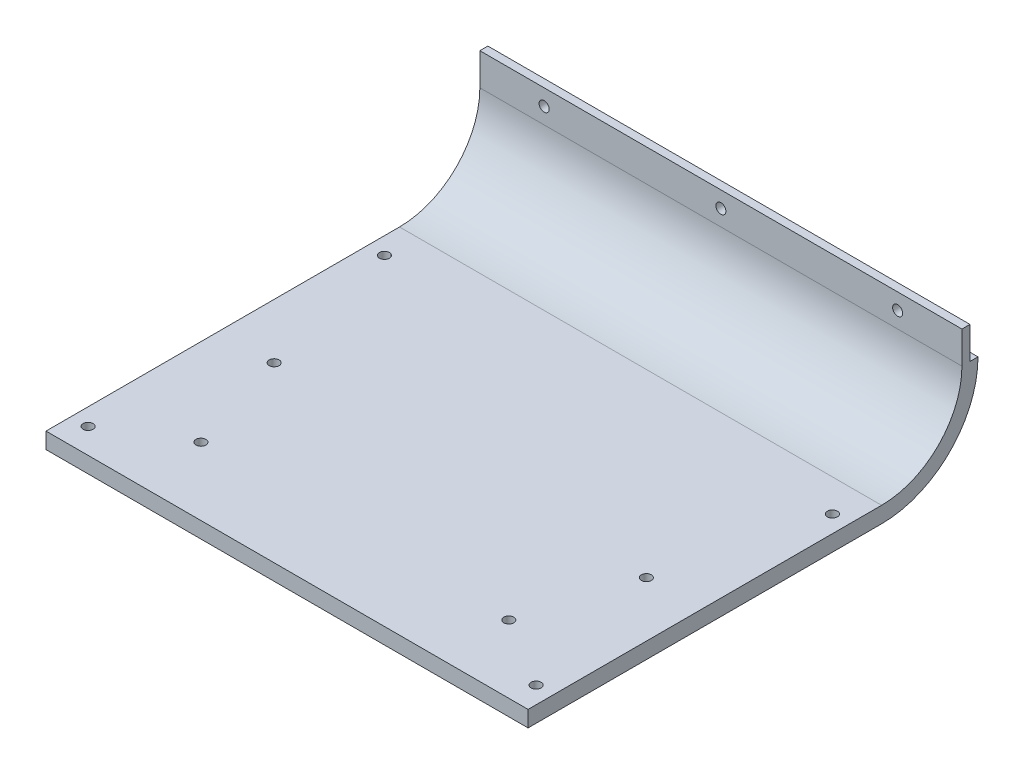
from build123d import *

# Parameters (mm, degrees)
BOSS_EXTRUDE1_DEPTH      = 190.5
BOSS_EXTRUDE1_DEPTH_BACK = 190.5
SKETCH2_W                = 381
SKETCH2_H                = 6.35
BOSS_EXTRUDE2_DEPTH      = 25.4
SKETCH3_R                = 3.96875
CUT_EXTRUDE1_DEPTH       = 25.4
SKETCH4_R                = 3.937
CUT_EXTRUDE2_DEPTH       = 302.34078715


with BuildPart() as part:
    # Sketch1 → Boss-Extrude1 (new, two sides: drawn at the far end of the back side and taken through both)
    with BuildSketch(Plane(origin=(0, 0, 0), x_dir=(0, 0, -1), z_dir=(1, 0, 0)).offset(-BOSS_EXTRUDE1_DEPTH_BACK)):
        with BuildLine():
            Line((-139.7, 0), (139.7, 0))
            ThreePointArc((139.7, 0), (193.581536726, 22.318463274), (215.9, 76.2))
            Line((215.9, 76.2), (203.2, 76.2))
            ThreePointArc((203.2, 76.2), (184.601280605, 31.298719395), (139.7, 12.7))
            Line((139.7, 12.7), (-139.7, 12.7))
            Line((-139.7, 12.7), (-139.7, 0))
        make_face()
    extrude(amount=BOSS_EXTRUDE1_DEPTH + BOSS_EXTRUDE1_DEPTH_BACK)

    # Sketch2 → Boss-Extrude2 (add)
    with BuildSketch(Plane(origin=(0, 76.2, 0), x_dir=(1, 0, 0), z_dir=(0, 1, 0))):
        with Locations((0, 206.375)):
            Rectangle(SKETCH2_W, SKETCH2_H)
    extrude(amount=BOSS_EXTRUDE2_DEPTH)

    # Sketch3 → Cut-Extrude1 (cut)
    with BuildSketch(Plane(origin=(0, 0, -209.55), x_dir=(-1, 0, 0), z_dir=(0, 0, -1))):
        with Locations((-139.7, 88.9)):
            Circle(SKETCH3_R)
        with Locations((139.7, 88.9)):
            Circle(SKETCH3_R)
        with Locations((0, 88.9)):
            Circle(SKETCH3_R)
    extrude(amount=-CUT_EXTRUDE1_DEPTH, mode=Mode.SUBTRACT)

    # Sketch4 → Cut-Extrude2 (cut, through all)
    with BuildSketch(Plane(origin=(0, 12.7, 0), x_dir=(1, 0, 0), z_dir=(0, 1, 0))):
        with Locations((177.038, -119.888)):
            Circle(SKETCH4_R)
        with Locations((177.038, 114.3)):
            Circle(SKETCH4_R)
        with Locations((-177.038, -119.888)):
            Circle(SKETCH4_R)
        with Locations((-177.038, 114.3)):
            Circle(SKETCH4_R)
        with Locations((147.066, -2.794)):
            Circle(SKETCH4_R)
        with Locations((-147.066, -2.794)):
            Circle(SKETCH4_R)
        with Locations((121.666, -86.106)):
            Circle(SKETCH4_R)
        with Locations((-121.666, -86.106)):
            Circle(SKETCH4_R)
    extrude(amount=-CUT_EXTRUDE2_DEPTH, mode=Mode.SUBTRACT)


solid = part.part
